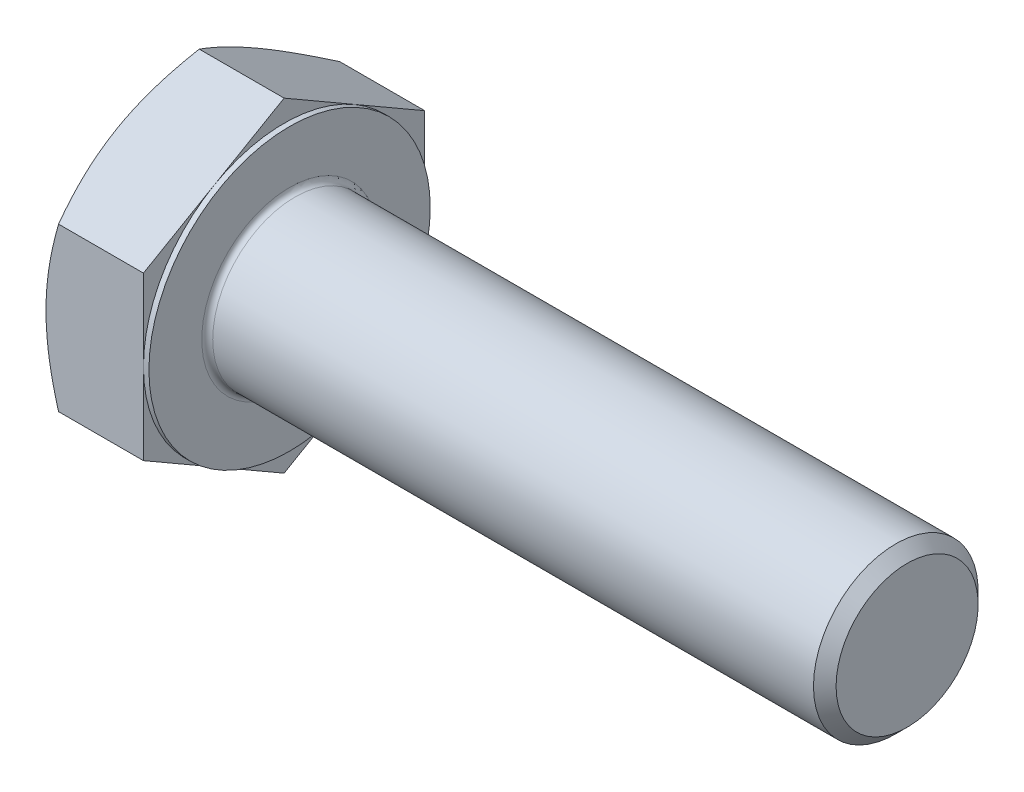
from build123d import *

# Parameters (mm, degrees)
BASEHEAD_DEPTH   = 15
BEARINGFACESKE_W = 0.8
BEARINGFACESKE_H = 3.171361037
FILLET_2_R       = 0.8


with BuildPart() as part:
    # BaseHeadSke → BaseHead (new body)
    with BuildSketch(Plane(origin=(0, 0, 0), x_dir=(0, 0, -1), z_dir=(1, 0, 0))):
        Polygon((20.5, 11.835680518), (0, 23.671361037), (-20.5, 11.835680518), (-20.5, -11.835680518), (0, -23.671361037), (20.5, -11.835680518), align=None)
    extrude(amount=BASEHEAD_DEPTH)

    # BodySke → BaseBody (revolve)
    with BuildSketch(Plane.XY):
        Polygon((0, 0), (105, 0), (105, 10.352), (103.352, 12), (0, 12), align=None)
    revolve(axis=Axis((0, 0, 0), (1, 0, 0)))

    # HeadChamferSke → HeadChamfer (revolve, cut)
    with BuildSketch(Plane.XY):
        Polygon((1.830986148, 23.671361037), (0, 23.671361037), (0, 20.5), align=None)
    revolve(axis=Axis((0, 0, 0), (1, 0, 0)), mode=Mode.SUBTRACT)

    # BearingFaceSke → BearingFace (revolve, cut)
    with BuildSketch(Plane.XY):
        with Locations((14.6, 22.085680518)):
            Rectangle(BEARINGFACESKE_W, BEARINGFACESKE_H)
    revolve(axis=Axis((0, 0, 0), (1, 0, 0)), mode=Mode.SUBTRACT)

    # Fillet 2
    fillet_2_edges = [part.edges().sort_by_distance(p)[0] for p in [
        (15, -12, 0),
    ]]
    fillet(fillet_2_edges, radius=FILLET_2_R)


solid = part.part
